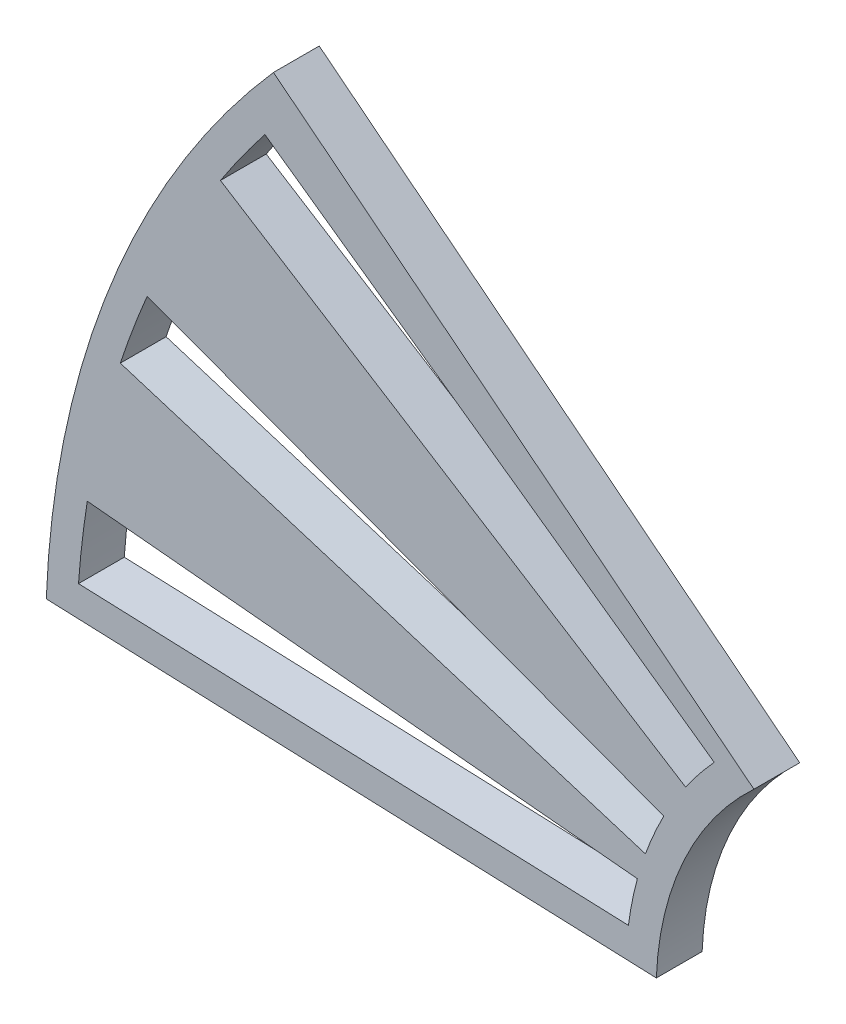
from build123d import *

# Parameters (mm, degrees)
BOSS_EXTRUDE2_DEPTH = 3
CUT_EXTRUDE1_DEPTH  = 72.917502797


with BuildPart() as part:
    # Sketch1 → Boss-Extrude2 (new body)
    with BuildSketch(Plane.XY):
        with BuildLine():
            Line((-19.985447982, 0.762803358), (-59.956343946, 2.288410074))
            ThreePointArc((-59.956343946, 2.288410074), (-55.730717245, 22.228071336), (-45.073672701, 39.602576043))
            Line((-45.073672701, 39.602576043), (-13.592462366, 14.67122922))
            ThreePointArc((-13.592462366, 14.67122922), (-18.172234131, 8.352838241), (-19.985447982, 0.762803358))
        make_face()
    extrude(amount=BOSS_EXTRUDE2_DEPTH)

    # Sketch1<5> → Cut-Extrude1 (cut, through all)
    with BuildSketch(Plane.XY):
        with BuildLine():
            ThreePointArc((-18.067243214, 12.552877066), (-17.245912522, 13.659374118), (-16.356919422, 14.712280144))
            Line((-16.356919422, 14.712280144), (-16.19149009, 14.894148135))
            Line((-16.19149009, 14.894148135), (-45.633154018, 35.799654388))
            ThreePointArc((-45.633154018, 35.799654388), (-47.133831778, 33.799436415), (-48.546898537, 31.736393028))
            Line((-48.546898537, 31.736393028), (-18.067243214, 12.552877066))
        make_face()
        with BuildLine():
            Line((-57.847050894, 4.209358967), (-21.816681027, 2.834154011))
            ThreePointArc((-21.816681027, 2.834154011), (-21.572673921, 4.315059664), (-21.2282638, 5.775882272))
            Line((-21.2282638, 5.775882272), (-57.269563461, 9.175897829))
            ThreePointArc((-57.269563461, 9.175897829), (-57.611850796, 6.698854216), (-57.847050894, 4.209358967))
        make_face()
        with BuildLine():
            Line((-55.106686022, 18.090139737), (-20.700540486, 7.449001516))
            ThreePointArc((-20.700540486, 7.449001516), (-20.144482043, 8.843067523), (-19.494667642, 10.19597634))
            Line((-19.494667642, 10.19597634), (-53.343874365, 22.769081398))
            ThreePointArc((-53.343874365, 22.769081398), (-54.275723264, 20.448615214), (-55.106686022, 18.090139737))
        make_face()
    extrude(amount=CUT_EXTRUDE1_DEPTH, mode=Mode.SUBTRACT)


solid = part.part
